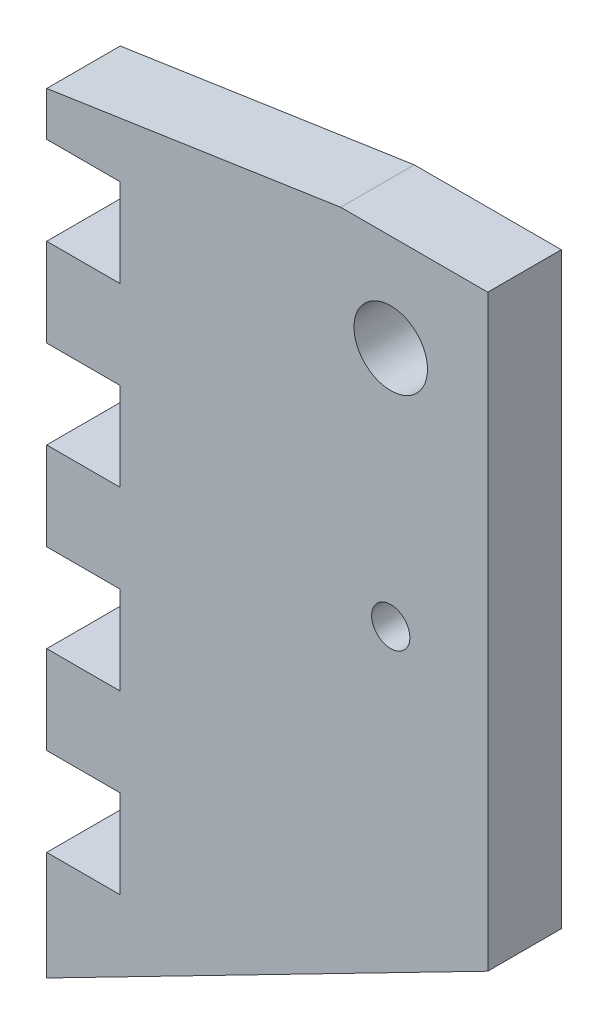
from build123d import *

# Parameters (mm, degrees)
SKETCH1_R           = 1.651
SKETCH1_R_2         = 3.175
BOSS_EXTRUDE1_DEPTH = 6.35
CUT_EXTRUDE1_DEPTH  = 8.636
SKETCH4_W           = 6.35
SKETCH4_H           = 7.62
CUT_EXTRUDE2_DEPTH  = 81.263196199


with BuildPart() as part:
    # Sketch1 → Boss-Extrude1 (new body)
    with BuildSketch(Plane.XY):
        Polygon((0, -50.8), (0, 0), (-38.1, 0), (-38.1, -7.62), (-31.75, -7.62), (-31.75, -15.24), (-38.1, -15.24), (-38.1, -22.86), (-31.75, -22.86), (-31.75, -30.48), (-38.1, -30.48), (-38.1, -38.1), (-31.75, -38.1), (-31.75, -45.72), (-38.1, -45.72), (-38.1, -70.358), align=None)
        with Locations((-8.382, -29.21)):
            Circle(SKETCH1_R, mode=Mode.SUBTRACT)
        with Locations((-8.382, -8.382)):
            Circle(SKETCH1_R_2, mode=Mode.SUBTRACT)
    extrude(amount=BOSS_EXTRUDE1_DEPTH)

    # Sketch2 → Cut-Extrude1 (cut)
    with BuildSketch(Plane(origin=(0, 0, 0), x_dir=(-1, 0, 0), z_dir=(0, 0, -1))):
        Polygon((38.1, 0), (12.7, 0), (38.1, -3.81), align=None)
    extrude(amount=-CUT_EXTRUDE1_DEPTH, mode=Mode.SUBTRACT)

    # Sketch4 → Cut-Extrude2 (cut, through all)
    with BuildSketch(Plane.XY.offset(6.35)):
        with Locations((-34.925, -57.15)):
            Rectangle(SKETCH4_W, SKETCH4_H)
    extrude(amount=-CUT_EXTRUDE2_DEPTH, mode=Mode.SUBTRACT)


solid = part.part
